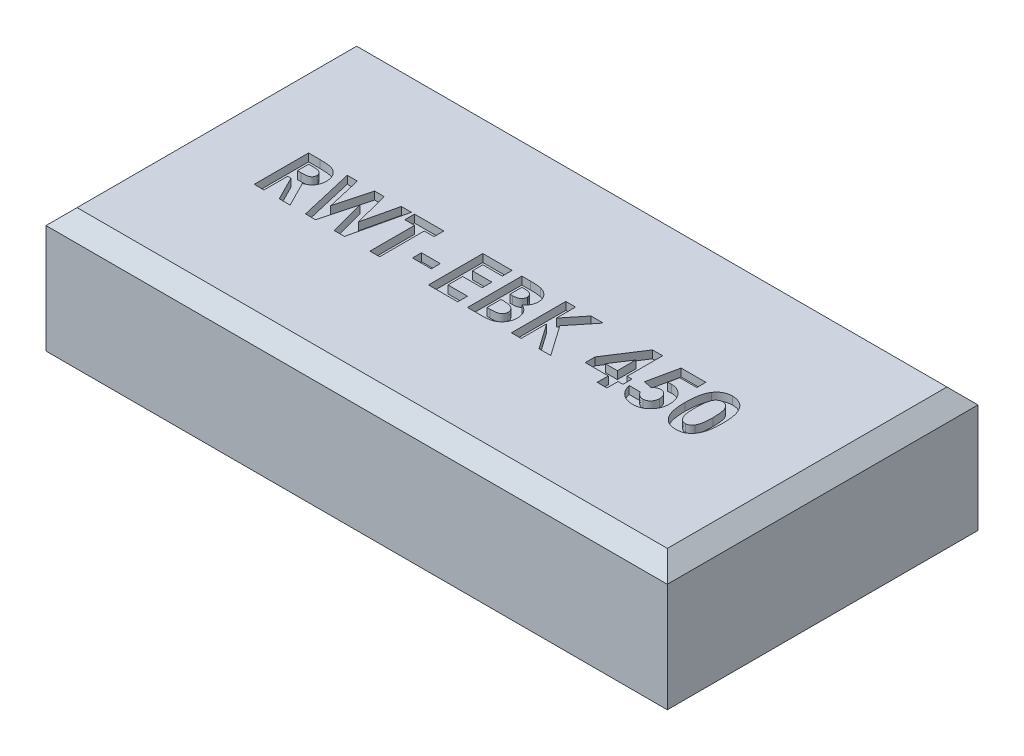
from build123d import *

# Parameters (mm, degrees)
SKETCH1_W           = 40
SKETCH1_H           = 20
BOSS_EXTRUDE1_DEPTH = 8
CHAMFER1_SIZE       = 1
SKETCH4_W           = 1.211538461
SKETCH4_H           = 0.583333333
CUT_EXTRUDE3_DEPTH  = 0.5


with BuildPart() as part:
    # Sketch1 → Boss-Extrude1 (new body)
    with BuildSketch(Plane(origin=(0, 0, 0), x_dir=(1, 0, 0), z_dir=(0, 1, 0))):
        with Locations((0, 2.318501171)):
            Rectangle(SKETCH1_W, SKETCH1_H)
    extrude(amount=BOSS_EXTRUDE1_DEPTH)

    # Chamfer1
    chamfer1_edges = [part.edges().sort_by_distance(p)[0] for p in [
        (0, 8, 7.681498829),
        (-20, 8, -2.318501171),
        (0, 8, -12.318501171),
        (20, 8, -2.318501171),
    ]]
    chamfer(chamfer1_edges, length=CHAMFER1_SIZE)

    # Sketch4 → Cut-Extrude3 (cut)
    # profile 1 of 10: a face of its own
    with BuildSketch(Plane(origin=(0, 8, 0), x_dir=(1, 0, 0), z_dir=(0, 1, 0))):
        with BuildLine():
            Line((-14.596153846, 3.818501171), (-13.864182692, 3.818501171))
            add(Edge.make_bspline(
                [(-13.864182692, 3.818501171), (-13.815799622, 3.818329439), (-13.722745349, 3.81799915), (-13.588566169, 3.81278806), (-13.46530414, 3.805536401), (-13.352776761, 3.794470177), (-13.251032173, 3.779797701), (-13.159968404, 3.76250128), (-13.079588115, 3.742788301), (-13.009213411, 3.718224373), (-12.945703721, 3.690516634), (-12.886503859, 3.658679935), (-12.830307791, 3.623068786), (-12.777491125, 3.582746162), (-12.727594872, 3.538437457), (-12.6805249, 3.49009807), (-12.636946351, 3.437318103), (-12.597129066, 3.380431058), (-12.560838815, 3.320587191), (-12.528765845, 3.257704336), (-12.502684052, 3.191738763), (-12.479637993, 3.123643816), (-12.463038663, 3.052446065), (-12.451494071, 2.978838632), (-12.443041573, 2.902562411), (-12.442555595, 2.850743733), (-12.442307692, 2.824310466)],
                knots=[0, 0, 0, 0, 1.749336639, 3.364467119, 4.854658419, 6.213483162, 7.451590619, 8.570285859, 9.5643256, 10.440900261, 11.26203566, 12.067320669, 12.869050712, 13.665104639, 14.467235401, 15.27997916, 16.102287765, 16.939272006, 17.78853747, 18.631303466, 19.488103222, 20.351255419, 21.228522269, 22.127379805, 23.044756219, 24, 24, 24, 24], degree=3))
            add(Edge.make_bspline(
                [(-12.442307692, 2.824310466), (-12.442951654, 2.796720207), (-12.444214347, 2.742620739), (-12.451015895, 2.663153032), (-12.46344699, 2.587123888), (-12.48227569, 2.514755912), (-12.503916836, 2.4451484), (-12.532694008, 2.379585653), (-12.565171892, 2.317114157), (-12.603744925, 2.258617595), (-12.646076944, 2.20279664), (-12.695308193, 2.151790002), (-12.748249241, 2.102856265), (-12.807876098, 2.059060474), (-12.871560358, 2.017441316), (-12.940567358, 1.979723274), (-13.014446736, 1.944958206), (-13.066387598, 1.925570802), (-13.092948718, 1.91565662)],
                knots=[0, 0, 0, 0, 1.099860209, 2.156625411, 3.176576793, 4.16617041, 5.135385252, 6.078461593, 7.016046972, 7.938469504, 8.868247731, 9.803980173, 10.76021508, 11.73834243, 12.748633912, 13.790971185, 14.870363756, 16, 16, 16, 16], degree=3))
            Line((-13.092948718, 1.91565662), (-12.28525641, 0.318501171))
            Line((-12.28525641, 0.318501171), (-12.983573718, 0.318501171))
            Line((-12.983573718, 0.318501171), (-13.754807692, 1.844142197))
            Line((-13.754807692, 1.844142197), (-13.967948718, 1.844142197))
            Line((-13.967948718, 1.844142197), (-13.967948718, 0.318501171))
            Line((-13.967948718, 0.318501171), (-14.596153846, 0.318501171))
            Line((-14.596153846, 0.318501171), (-14.596153846, 3.818501171))
        make_face()
        with BuildLine():
            Line((-13.967948718, 2.472347325), (-13.723257212, 2.472347325))
            add(Edge.make_bspline(
                [(-13.723257212, 2.472347325), (-13.693341641, 2.472684254), (-13.636059751, 2.473329401), (-13.55368087, 2.476321861), (-13.4788612, 2.483532211), (-13.41127944, 2.492642218), (-13.350595524, 2.503161037), (-13.297350732, 2.518235143), (-13.250724642, 2.534387429), (-13.211269776, 2.554460531), (-13.177560445, 2.577288002), (-13.148454596, 2.603220576), (-13.124379885, 2.633234229), (-13.104565169, 2.666513318), (-13.089151475, 2.70335219), (-13.07790066, 2.743346436), (-13.071613117, 2.786951643), (-13.070889714, 2.817045173), (-13.070512821, 2.832723927)],
                knots=[0, 0, 0, 0, 1.688639943, 3.233382647, 4.650958383, 5.928841754, 7.082724185, 8.122798841, 9.049171256, 9.863274652, 10.613301712, 11.341792392, 12.054588806, 12.776240173, 13.521029143, 14.301969904, 15.115324896, 16, 16, 16, 16], degree=3))
            add(Edge.make_bspline(
                [(-13.070512821, 2.832723927), (-13.071225372, 2.851273039), (-13.072625049, 2.88770933), (-13.086514186, 2.940164814), (-13.108622693, 2.988715953), (-13.1389274, 3.033143381), (-13.177092239, 3.072091531), (-13.220889403, 3.106424636), (-13.27126414, 3.133572687), (-13.317907356, 3.151479252), (-13.36034178, 3.162192934), (-13.398637509, 3.170176676), (-13.442984193, 3.175834983), (-13.493415313, 3.181836624), (-13.549802317, 3.185728385), (-13.612452548, 3.188568594), (-13.681186076, 3.189730664), (-13.729099873, 3.190102157), (-13.754106571, 3.190296043)],
                knots=[0, 0, 0, 0, 1.020303359, 2.004196876, 2.966617323, 3.9489082, 4.950758222, 5.960522915, 7.003732012, 8.091992268, 8.70421221, 9.413913587, 10.24622431, 11.166358409, 12.212345909, 13.359657661, 14.621978493, 16, 16, 16, 16], degree=3))
            Line((-13.754106571, 3.190296043), (-13.967948718, 3.190296043))
            Line((-13.967948718, 3.190296043), (-13.967948718, 2.472347325))
        make_face(mode=Mode.SUBTRACT)
    # profile 2 of 10: a face of its own
    with BuildSketch(Plane(origin=(0, 8, 0), x_dir=(1, 0, 0), z_dir=(0, 1, 0))):
        Polygon((-12.105769231, 3.818501171), (-11.457231571, 3.818501171), (-10.939102564, 1.584026011), (-10.345252404, 3.818501171), (-9.734575321, 3.818501171), (-9.144230769, 1.584026011), (-8.627504006, 3.818501171), (-7.977564103, 3.818501171), (-8.787359776, 0.318501171), (-9.443609776, 0.318501171), (-10.041666667, 2.581021203), (-10.643229167, 0.318501171), (-11.294571314, 0.318501171), align=None)
    # profile 3 of 10: a face of its own
    with BuildSketch(Plane(origin=(0, 8, 0), x_dir=(1, 0, 0), z_dir=(0, 1, 0))):
        Polygon((-7.775641026, 3.818501171), (-5.891025641, 3.818501171), (-5.891025641, 3.190296043), (-6.519230769, 3.190296043), (-6.519230769, 0.318501171), (-7.147435897, 0.318501171), (-7.147435897, 3.190296043), (-7.775641026, 3.190296043), align=None)
    # profile 4 of 10: a face of its own
    with BuildSketch(Plane(origin=(0, 8, 0), x_dir=(1, 0, 0), z_dir=(0, 1, 0))):
        with Locations((-4.791666667, 1.597347325)):
            Rectangle(SKETCH4_W, SKETCH4_H)
    # profile 5 of 10: a face of its own
    with BuildSketch(Plane(origin=(0, 8, 0), x_dir=(1, 0, 0), z_dir=(0, 1, 0))):
        Polygon((-3.378205128, 3.818501171), (-1.493589744, 3.818501171), (-1.493589744, 3.190296043), (-2.75, 3.190296043), (-2.75, 2.51721912), (-1.493589744, 2.51721912), (-1.493589744, 1.889013991), (-2.75, 1.889013991), (-2.75, 0.946706299), (-1.493589744, 0.946706299), (-1.493589744, 0.318501171), (-3.378205128, 0.318501171), align=None)
    # profile 6 of 10: a face of its own
    with BuildSketch(Plane(origin=(0, 8, 0), x_dir=(1, 0, 0), z_dir=(0, 1, 0))):
        with BuildLine():
            Line((-0.865384615, 0.318501171), (-0.865384615, 3.818501171))
            Line((-0.865384615, 3.818501171), (-0.304487179, 3.818501171))
            add(Edge.make_bspline(
                [(-0.304487179, 3.818501171), (-0.265220852, 3.818505652), (-0.189241252, 3.818514323), (-0.079622519, 3.814664873), (0.022039599, 3.809685178), (0.115421572, 3.804114058), (0.200682344, 3.794513904), (0.277692262, 3.784396391), (0.346605192, 3.772195293), (0.389210312, 3.76125053), (0.409254808, 3.756101331)],
                knots=[0, 0, 0, 0, 1.311965854, 2.538629056, 3.664479157, 4.713267157, 5.663616078, 6.530575999, 7.308677837, 8, 8, 8, 8], degree=3))
            add(Edge.make_bspline(
                [(0.409254808, 3.756101331), (0.435575266, 3.748838294), (0.487224455, 3.734585883), (0.561202576, 3.705802524), (0.631381143, 3.673807779), (0.697674471, 3.637307759), (0.759675491, 3.595861807), (0.817148578, 3.549140995), (0.871333285, 3.499020694), (0.920305637, 3.444104065), (0.964568575, 3.386074475), (1.003025131, 3.324947127), (1.03643895, 3.2616567), (1.063178757, 3.195406725), (1.083326699, 3.126502301), (1.09806282, 3.055237661), (1.107613822, 2.981387306), (1.108516267, 2.931144495), (1.108974359, 2.905640594)],
                knots=[0, 0, 0, 0, 1.099996261, 2.158545794, 3.195537121, 4.207578794, 5.205712374, 6.197378256, 7.190519799, 8.17788031, 9.159561366, 10.129234751, 11.085776129, 12.040971148, 13.00380137, 13.975669004, 14.972423361, 16, 16, 16, 16], degree=3))
            add(Edge.make_bspline(
                [(1.108974359, 2.905640594), (1.107776583, 2.872874775), (1.105418909, 2.808379286), (1.090357925, 2.713647082), (1.062116233, 2.624111532), (1.025162666, 2.538122532), (0.974917368, 2.456000819), (0.911115557, 2.377785442), (0.834790614, 2.30106803), (0.776245169, 2.255081117), (0.745793269, 2.231161427)],
                knots=[0, 0, 0, 0, 0.986156485, 1.941127874, 2.875419072, 3.804401753, 4.751181392, 5.761612777, 6.835722519, 8, 8, 8, 8], degree=3))
            add(Edge.make_bspline(
                [(0.745793269, 2.231161427), (0.770470028, 2.218564156), (0.818854324, 2.193864392), (0.887545811, 2.153265354), (0.951146629, 2.110083128), (1.009941945, 2.065186558), (1.062698461, 2.016672412), (1.111594582, 1.967336144), (1.154218027, 1.914350989), (1.192333195, 1.85960544), (1.225462281, 1.802306775), (1.254314061, 1.742551757), (1.278684124, 1.680136252), (1.299321324, 1.615377904), (1.314712554, 1.548053973), (1.324747963, 1.478140383), (1.332431699, 1.405875574), (1.333029422, 1.35665059), (1.333333333, 1.331622165)],
                knots=[0, 0, 0, 0, 1.164658916, 2.283573913, 3.35186032, 4.395461096, 5.390182219, 6.362969632, 7.312859996, 8.245001507, 9.165155236, 10.092416118, 11.032087915, 11.979892451, 12.947605196, 13.931445124, 14.948243989, 16, 16, 16, 16], degree=3))
            add(Edge.make_bspline(
                [(1.333333333, 1.331622165), (1.331361149, 1.283819302), (1.327469051, 1.189480545), (1.29901193, 1.050969584), (1.249676325, 0.91964863), (1.18342878, 0.796039608), (1.101799059, 0.683720797), (1.007948289, 0.585330494), (0.902821331, 0.502045287), (0.805829006, 0.445834233), (0.721938284, 0.40811136), (0.652453165, 0.384788701), (0.577827621, 0.363182624), (0.49669469, 0.348010391), (0.410525202, 0.334123096), (0.318478999, 0.325548791), (0.220728113, 0.319738197), (0.153588579, 0.318921849), (0.118990385, 0.318501171)],
                knots=[0, 0, 0, 0, 1.284142165, 2.534249414, 3.780121997, 5.041676246, 6.291546858, 7.49970053, 8.684500223, 9.883330709, 10.50184324, 11.153274765, 11.851151195, 12.587658647, 13.369265475, 14.195992086, 15.070362669, 16, 16, 16, 16], degree=3))
            Line((0.118990385, 0.318501171), (-0.865384615, 0.318501171))
        make_face()
        with BuildLine():
            Line((-0.237179487, 3.190296043), (-0.237179487, 2.42747553))
            Line((-0.237179487, 2.42747553), (-0.0703125, 2.42747553))
            add(Edge.make_bspline(
                [(-0.0703125, 2.42747553), (-0.047633777, 2.427673297), (-0.003853875, 2.428055074), (0.059381549, 2.432972233), (0.118180282, 2.441361212), (0.172319311, 2.453065948), (0.222302963, 2.467929257), (0.267811927, 2.485813017), (0.308646108, 2.507633149), (0.356085982, 2.540135198), (0.406233349, 2.587963419), (0.450377513, 2.657061193), (0.476378131, 2.736523371), (0.479273899, 2.792566252), (0.480769231, 2.821505979)],
                knots=[0, 0, 0, 0, 1.065314748, 2.056525647, 2.977365736, 3.853934255, 4.656397591, 5.425096493, 6.14721249, 6.826394842, 8.123232004, 9.372140726, 10.643011755, 12, 12, 12, 12], degree=3))
            add(Edge.make_bspline(
                [(0.480769231, 2.821505979), (0.479572691, 2.848612841), (0.47725923, 2.901022871), (0.451079951, 2.97461122), (0.410418355, 3.039825558), (0.362411626, 3.084459439), (0.317203962, 3.114943064), (0.278494386, 3.135015233), (0.236007719, 3.152983634), (0.188921466, 3.166722711), (0.137504514, 3.17703203), (0.082006625, 3.184602991), (0.022332045, 3.189756109), (-0.018885315, 3.190112204), (-0.040164263, 3.190296043)],
                knots=[0, 0, 0, 0, 1.347982417, 2.606269829, 3.849316587, 5.153353503, 5.842674298, 6.568177932, 7.326619318, 8.142485038, 9.012069166, 9.942760135, 10.937925643, 12, 12, 12, 12], degree=3))
            Line((-0.040164263, 3.190296043), (-0.237179487, 3.190296043))
        make_face(mode=Mode.SUBTRACT)
        with BuildLine():
            Line((-0.237179487, 1.844142197), (-0.237179487, 0.946706299))
            Line((-0.237179487, 0.946706299), (-0.056290064, 0.946706299))
            add(Edge.make_bspline(
                [(-0.056290064, 0.946706299), (-0.020527995, 0.946910607), (0.048229046, 0.947303413), (0.146723385, 0.952049449), (0.236279363, 0.960603342), (0.316659689, 0.971282188), (0.387987483, 0.985750355), (0.450021639, 1.004144774), (0.503612874, 1.02438184), (0.548439854, 1.049377018), (0.585060929, 1.078465208), (0.618107609, 1.108194036), (0.645051813, 1.142489048), (0.666370569, 1.179878054), (0.684821916, 1.219432285), (0.695950465, 1.262696318), (0.704423352, 1.308387911), (0.704889637, 1.339991798), (0.705128205, 1.356161427)],
                knots=[0, 0, 0, 0, 1.753078804, 3.370512758, 4.83203934, 6.162291463, 7.344201807, 8.395507345, 9.331626367, 10.147333109, 10.898971645, 11.62040215, 12.321813352, 13.025280112, 13.727906689, 14.453419512, 15.208716525, 16, 16, 16, 16], degree=3))
            add(Edge.make_bspline(
                [(0.705128205, 1.356161427), (0.704602095, 1.374651653), (0.703577374, 1.410665639), (0.695208464, 1.463303922), (0.67999942, 1.512445252), (0.660842888, 1.559346239), (0.634185556, 1.602327663), (0.602504228, 1.642876951), (0.564225095, 1.679620976), (0.521177978, 1.714782156), (0.470967777, 1.745567673), (0.413570936, 1.772279563), (0.348675643, 1.79458835), (0.27608088, 1.81235062), (0.196104895, 1.827425213), (0.108163951, 1.83642641), (0.012990452, 1.843120995), (-0.053004401, 1.843794061), (-0.087139423, 1.844142197)],
                knots=[0, 0, 0, 0, 0.845221588, 1.646264278, 2.427170338, 3.19324141, 3.95557735, 4.731569926, 5.540061037, 6.376114724, 7.268642756, 8.224665384, 9.265483498, 10.400594375, 11.639216012, 12.983232105, 14.439614077, 16, 16, 16, 16], degree=3))
            Line((-0.087139423, 1.844142197), (-0.237179487, 1.844142197))
        make_face(mode=Mode.SUBTRACT)
    # profile 7 of 10: a face of its own
    with BuildSketch(Plane(origin=(0, 8, 0), x_dir=(1, 0, 0), z_dir=(0, 1, 0))):
        Polygon((1.961538462, 3.818501171), (2.58974359, 3.818501171), (2.58974359, 2.586630177), (3.582532051, 3.818501171), (4.375500801, 3.818501171), (3.128205128, 2.270424248), (4.496794872, 0.318501171), (3.740284455, 0.318501171), (2.58974359, 1.959827293), (2.58974359, 0.318501171), (1.961538462, 0.318501171), align=None)
    # profile 8 of 10: a face of its own
    with BuildSketch(Plane(origin=(0, 8, 0), x_dir=(1, 0, 0), z_dir=(0, 1, 0))):
        Polygon((7.454126603, 3.908244761), (8.108974359, 3.908244761), (8.108974359, 1.619783222), (8.423076923, 1.619783222), (8.423076923, 1.036449889), (8.108974359, 1.036449889), (8.108974359, 0.318501171), (7.480769231, 0.318501171), (7.480769231, 1.036449889), (6, 1.036449889), (6, 1.672367357), align=None)
        Polygon((7.480769231, 1.619783222), (7.480769231, 2.810989152), (6.706029647, 1.619783222), align=None, mode=Mode.SUBTRACT)
    # profile 9 of 10: a face of its own
    with BuildSketch(Plane(origin=(0, 8, 0), x_dir=(1, 0, 0), z_dir=(0, 1, 0))):
        with BuildLine():
            Line((9.387119391, 3.818501171), (10.980769231, 3.818501171))
            Line((10.980769231, 3.818501171), (10.980769231, 3.235167838))
            Line((10.980769231, 3.235167838), (9.884915865, 3.235167838))
            Line((9.884915865, 3.235167838), (9.748197115, 2.573308863))
            add(Edge.make_bspline(
                [(9.748197115, 2.573308863), (9.766827002, 2.578497522), (9.803568967, 2.588730623), (9.858920782, 2.598993128), (9.912564404, 2.605644958), (9.947765022, 2.606532224), (9.96484375, 2.606962709)],
                knots=[0, 0, 0, 0, 1.05461699, 2.079921384, 3.068411212, 4, 4, 4, 4], degree=3))
            add(Edge.make_bspline(
                [(9.96484375, 2.606962709), (10.002060088, 2.606109919), (10.075421688, 2.60442888), (10.1827404, 2.588470341), (10.285504407, 2.563336125), (10.383399238, 2.527489548), (10.476329265, 2.480834303), (10.564407137, 2.424394534), (10.647740954, 2.358071113), (10.724850358, 2.281822516), (10.795701698, 2.19809983), (10.857302898, 2.107544887), (10.909914167, 2.011448911), (10.951759351, 1.909214572), (10.984787138, 1.801483971), (11.008653754, 1.688188071), (11.022767277, 1.569192598), (11.024670399, 1.488010495), (11.025641026, 1.446606139)],
                knots=[0, 0, 0, 0, 1.01440847, 1.999622559, 2.951875003, 3.895578053, 4.836219714, 5.782137149, 6.743708247, 7.735272588, 8.734977101, 9.730283169, 10.717124674, 11.717316708, 12.737475749, 13.78628267, 14.87096371, 16, 16, 16, 16], degree=3))
            add(Edge.make_bspline(
                [(11.025641026, 1.446606139), (11.024454904, 1.404731748), (11.022114339, 1.322101333), (11.006844297, 1.200605395), (10.979892399, 1.084239715), (10.94287127, 0.972692784), (10.894098303, 0.866784445), (10.835442135, 0.765417568), (10.765911048, 0.669344566), (10.68618738, 0.579550304), (10.599517296, 0.497476624), (10.507234115, 0.425276252), (10.409986156, 0.364520223), (10.30777107, 0.31541908), (10.2011753, 0.276571129), (10.090166491, 0.248291676), (9.974205155, 0.232074981), (9.895482475, 0.229875532), (9.85546875, 0.228757581)],
                knots=[0, 0, 0, 0, 1.06808661, 2.107647099, 3.116961351, 4.110378221, 5.100014249, 6.085620622, 7.093190682, 8.119403071, 9.144090782, 10.133780668, 11.103064255, 12.062861538, 13.020824475, 13.992378307, 14.979551724, 16, 16, 16, 16], degree=3))
            add(Edge.make_bspline(
                [(9.85546875, 0.228757581), (9.819685666, 0.229672135), (9.749113937, 0.231475826), (9.645164879, 0.242562264), (9.544946443, 0.262163189), (9.44899068, 0.290530803), (9.356287975, 0.32544486), (9.267909998, 0.369111487), (9.183371097, 0.420699211), (9.102911331, 0.479266557), (9.027838055, 0.545240399), (8.959319124, 0.617460138), (8.896939715, 0.695015476), (8.84203465, 0.778863212), (8.79477604, 0.868879466), (8.75286614, 0.964003375), (8.718562467, 1.065228337), (8.701154341, 1.135403104), (8.692307692, 1.171065274)],
                knots=[0, 0, 0, 0, 1.054957082, 2.080596141, 3.077793124, 4.061112343, 5.027190972, 5.994718051, 6.962465889, 7.943658696, 8.924948258, 9.904494768, 10.875059, 11.855380583, 12.854004648, 13.869083016, 14.917087635, 16, 16, 16, 16], degree=3))
            Line((8.692307692, 1.171065274), (9.41025641, 1.171065274))
            add(Edge.make_bspline(
                [(9.41025641, 1.171065274), (9.42338053, 1.146352842), (9.448885759, 1.098327052), (9.497402344, 1.034565599), (9.551713581, 0.980192572), (9.611329552, 0.934676733), (9.676636533, 0.900577041), (9.744973386, 0.874717413), (9.8171986, 0.859774091), (9.86638716, 0.857906028), (9.891225962, 0.856962709)],
                knots=[0, 0, 0, 0, 1.104910296, 2.147267069, 3.153527244, 4.136738762, 5.099945312, 6.05603338, 7.018353, 8, 8, 8, 8], degree=3))
            add(Edge.make_bspline(
                [(9.891225962, 0.856962709), (9.908538273, 0.857614079), (9.942600538, 0.858895659), (9.9927859, 0.86567554), (10.040690032, 0.87851648), (10.086669091, 0.896298197), (10.130846587, 0.918474006), (10.172589223, 0.946469521), (10.212623243, 0.978693396), (10.250339168, 1.015670402), (10.284498925, 1.056891163), (10.314453296, 1.10118568), (10.341236634, 1.14756972), (10.361075462, 1.197880672), (10.377321784, 1.250616232), (10.389286233, 1.306174201), (10.396436341, 1.364619465), (10.397098249, 1.404518409), (10.397435897, 1.424871363)],
                knots=[0, 0, 0, 0, 0.978869489, 1.925942215, 2.855067702, 3.774946051, 4.70828698, 5.642468714, 6.60995405, 7.609372294, 8.622401667, 9.629904756, 10.629323, 11.642352373, 12.678539694, 13.745912462, 14.850161547, 16, 16, 16, 16], degree=3))
            add(Edge.make_bspline(
                [(10.397435897, 1.424871363), (10.397044018, 1.444751879), (10.396281215, 1.483449786), (10.389971156, 1.540272174), (10.378682582, 1.594186337), (10.363301804, 1.645605217), (10.343612571, 1.694216573), (10.319551013, 1.740309765), (10.291014335, 1.783651807), (10.257849331, 1.823360298), (10.222482512, 1.859782055), (10.184487184, 1.891636234), (10.144205664, 1.918072991), (10.102889652, 1.941153049), (10.05888996, 1.957950212), (10.013195966, 1.969517798), (9.965855722, 1.978005628), (9.933565969, 1.978504319), (9.917167468, 1.978757581)],
                knots=[0, 0, 0, 0, 1.166249705, 2.270133367, 3.348514167, 4.393962215, 5.415026464, 6.420877785, 7.440098956, 8.453121383, 9.451844239, 10.415694839, 11.355045125, 12.27538808, 13.187007209, 14.108269027, 15.039275622, 16, 16, 16, 16], degree=3))
            add(Edge.make_bspline(
                [(9.917167468, 1.978757581), (9.899354884, 1.978081693), (9.863654645, 1.976727067), (9.810613025, 1.965704839), (9.75821094, 1.94786674), (9.706156979, 1.923256255), (9.654967869, 1.891048895), (9.603292704, 1.853273355), (9.552861163, 1.807184883), (9.520795387, 1.772858084), (9.504206731, 1.755099729)],
                knots=[0, 0, 0, 0, 0.88288272, 1.769486374, 2.674910571, 3.623812639, 4.617874466, 5.670434592, 6.794841017, 8, 8, 8, 8], degree=3))
            Line((9.504206731, 1.755099729), (8.975560897, 1.876393799))
            Line((8.975560897, 1.876393799), (9.387119391, 3.818501171))
        make_face()
    # profile 10 of 10: a face of its own
    with BuildSketch(Plane(origin=(0, 8, 0), x_dir=(1, 0, 0), z_dir=(0, 1, 0))):
        with BuildLine():
            add(Edge.make_bspline(
                [(12.608072917, 3.908244761), (12.638480652, 3.907793349), (12.698270385, 3.906905754), (12.786329406, 3.897292372), (12.871154591, 3.882769234), (12.953077785, 3.86251452), (13.031509297, 3.835708128), (13.107019968, 3.803621336), (13.178711003, 3.764571127), (13.247496691, 3.720461909), (13.313350535, 3.670524021), (13.374689786, 3.613592251), (13.432634627, 3.550976601), (13.485930767, 3.481730434), (13.535758465, 3.406483618), (13.581953994, 3.325224221), (13.624163718, 3.237554532), (13.662860706, 3.143316345), (13.697463675, 3.04109707), (13.726609713, 2.929724208), (13.751607317, 2.809172324), (13.772707059, 2.679141347), (13.788655053, 2.539458435), (13.799404323, 2.390216385), (13.80678098, 2.231702915), (13.807383012, 2.122963977), (13.807692308, 2.067098927)],
                knots=[0, 0, 0, 0, 0.879237366, 1.728815576, 2.559023295, 3.367336655, 4.166867292, 4.954216142, 5.737608147, 6.525189134, 7.316157332, 8.124696809, 8.942788509, 9.781158001, 10.649253743, 11.551476218, 12.482711956, 13.461909668, 14.496590415, 15.601789533, 16.789733467, 18.056700938, 19.410929216, 20.8549011, 22.384193279, 24, 24, 24, 24], degree=3))
            add(Edge.make_bspline(
                [(13.807692308, 2.067098927), (13.807358042, 2.010534943), (13.806708571, 1.900632136), (13.799710973, 1.740668821), (13.787660778, 1.590343185), (13.772129618, 1.449670779), (13.750856176, 1.31872589), (13.725942019, 1.19716946), (13.69633592, 1.085045549), (13.660593141, 0.982606796), (13.622130387, 0.888203106), (13.579805201, 0.800704352), (13.534355307, 0.71987354), (13.486823186, 0.644491226), (13.434602955, 0.576779642), (13.380236318, 0.514436242), (13.321356056, 0.459835764), (13.260441254, 0.410164346), (13.195260358, 0.367238273), (13.12648556, 0.329695837), (13.052890726, 0.299244462), (12.975817364, 0.272759483), (12.893951743, 0.253746125), (12.808594697, 0.238659651), (12.718782561, 0.23032194), (12.657634842, 0.229287592), (12.626302083, 0.228757581)],
                knots=[0, 0, 0, 0, 1.643780988, 3.193836972, 4.651895693, 6.025988579, 7.305620092, 8.505800249, 9.631074763, 10.672816429, 11.65661981, 12.592235626, 13.49536222, 14.350718032, 15.179365177, 15.97804903, 16.751647189, 17.51006938, 18.259804725, 19.016521909, 19.783502495, 20.571750527, 21.382245291, 22.22305063, 23.089471752, 24, 24, 24, 24], degree=3))
            add(Edge.make_bspline(
                [(12.626302083, 0.228757581), (12.59497017, 0.229297816), (12.533591414, 0.230356128), (12.443536417, 0.238597657), (12.357727022, 0.253807241), (12.275213712, 0.272905453), (12.196570768, 0.299185861), (12.1214211, 0.330548319), (12.050342543, 0.367856509), (11.983138292, 0.410882596), (11.920037802, 0.460221675), (11.86006049, 0.515346009), (11.803339031, 0.576115872), (11.750736299, 0.643211936), (11.701390812, 0.71573861), (11.655817167, 0.794524112), (11.614042751, 0.879453732), (11.574760854, 0.970645855), (11.540629858, 1.070063741), (11.510254856, 1.17859518), (11.485372454, 1.297144871), (11.46536036, 1.425674728), (11.449382717, 1.563912456), (11.437497186, 1.711924777), (11.43046072, 1.869780633), (11.429818059, 1.978282826), (11.429487179, 2.034146203)],
                knots=[0, 0, 0, 0, 0.917216111, 1.796812873, 2.643793957, 3.46689424, 4.273913431, 5.068098542, 5.848489301, 6.620921603, 7.401012384, 8.190319798, 9.003608147, 9.831726257, 10.68377682, 11.569763213, 12.493818149, 13.453288342, 14.474581811, 15.568529029, 16.750744269, 18.018426408, 19.375425659, 20.823733699, 22.36466933, 24, 24, 24, 24], degree=3))
            add(Edge.make_bspline(
                [(11.429487179, 2.034146203), (11.430086537, 2.111763968), (11.431243006, 2.261528446), (11.445898626, 2.477894573), (11.46740936, 2.677887577), (11.499003532, 2.861172919), (11.538069289, 3.028429436), (11.588095025, 3.178555327), (11.645045686, 3.313627923), (11.693574966, 3.393645742), (11.716947115, 3.432183062)],
                knots=[0, 0, 0, 0, 1.288568992, 2.486310467, 3.599230591, 4.627010532, 5.572937695, 6.447898582, 7.252493626, 8, 8, 8, 8], degree=3))
            add(Edge.make_bspline(
                [(11.716947115, 3.432183062), (11.744123137, 3.470042113), (11.797257615, 3.544064019), (11.890164735, 3.641240945), (11.989981339, 3.72435141), (12.098757603, 3.791514551), (12.214773185, 3.844479409), (12.339024139, 3.881887892), (12.471051626, 3.903683818), (12.561717103, 3.906701743), (12.608072917, 3.908244761)],
                knots=[0, 0, 0, 0, 1.058512271, 2.069600068, 3.047294572, 4.004278952, 4.967380941, 5.939006123, 6.946246673, 8, 8, 8, 8], degree=3))
        make_face()
        with BuildLine():
            add(Edge.make_bspline(
                [(12.623497596, 3.280039632), (12.596008751, 3.278736716), (12.542116023, 3.276182308), (12.463915106, 3.254498986), (12.390176524, 3.221007927), (12.334085555, 3.180706674), (12.292102022, 3.142073089), (12.262767826, 3.107110952), (12.234479618, 3.068095726), (12.209494048, 3.023266856), (12.185901148, 2.974235095), (12.162843773, 2.920777869), (12.14394278, 2.861582152), (12.125373055, 2.797656056), (12.109104244, 2.727232193), (12.095474546, 2.649734927), (12.08329761, 2.564660285), (12.074804052, 2.471952543), (12.066885506, 2.371708697), (12.061209118, 2.263705442), (12.058835962, 2.147971914), (12.058081608, 2.068267952), (12.057692308, 2.027134985)],
                knots=[0, 0, 0, 0, 1.076674018, 2.110852608, 3.161083442, 4.239746716, 4.804137807, 5.395870207, 6.026861976, 6.692161227, 7.405688833, 8.16177676, 8.973626916, 9.841385931, 10.773283133, 11.807421078, 12.927755683, 14.143907515, 15.458935494, 16.872852025, 18.386167141, 20, 20, 20, 20], degree=3))
            add(Edge.make_bspline(
                [(12.057692308, 2.027134985), (12.05833305, 1.973845238), (12.05956172, 1.871658197), (12.065996919, 1.724709674), (12.078895741, 1.590974686), (12.094939272, 1.46954686), (12.117473067, 1.361213689), (12.143399656, 1.264950241), (12.175416688, 1.181983641), (12.212418538, 1.111114005), (12.253399754, 1.050825352), (12.297886667, 0.999579726), (12.344364656, 0.955203432), (12.394284452, 0.919157115), (12.44752696, 0.891532879), (12.503647703, 0.871663107), (12.562682345, 0.859499993), (12.603108659, 0.85781336), (12.623497596, 0.856962709)],
                knots=[0, 0, 0, 0, 1.771748488, 3.397459088, 4.888034009, 6.237357457, 7.467047327, 8.564189669, 9.548206622, 10.417051504, 11.216568818, 11.965764335, 12.669334354, 13.348544111, 14.005342236, 14.656555988, 15.322436492, 16, 16, 16, 16], degree=3))
            add(Edge.make_bspline(
                [(12.623497596, 0.856962709), (12.64318685, 0.857544788), (12.681735959, 0.858684424), (12.737949195, 0.87038264), (12.791108425, 0.889401398), (12.841053145, 0.916304766), (12.887962, 0.950516515), (12.931605729, 0.992186986), (12.971655179, 1.041731537), (12.994988171, 1.07850092), (13.007011218, 1.097447485)],
                knots=[0, 0, 0, 0, 0.992283464, 1.942767638, 2.88273346, 3.832339453, 4.79467288, 5.803907806, 6.868395428, 8, 8, 8, 8], degree=3))
            add(Edge.make_bspline(
                [(13.007011218, 1.097447485), (13.021166331, 1.12333736), (13.050848455, 1.177626329), (13.085196661, 1.269236938), (13.114109066, 1.372558565), (13.13899355, 1.487912756), (13.156013019, 1.615754481), (13.170670165, 1.755273086), (13.177739671, 1.907171129), (13.178889565, 2.012406641), (13.179487179, 2.067098927)],
                knots=[0, 0, 0, 0, 0.710965849, 1.490837728, 2.352621235, 3.297892224, 4.334225155, 5.461620853, 6.680770821, 8, 8, 8, 8], degree=3))
            add(Edge.make_bspline(
                [(13.179487179, 2.067098927), (13.179256334, 2.122265969), (13.178811995, 2.228453106), (13.170659668, 2.380897234), (13.15930693, 2.520129644), (13.142701151, 2.645839487), (13.121334799, 2.758331932), (13.095000689, 2.857599625), (13.063954732, 2.943838204), (13.027137927, 3.016961676), (12.986361029, 3.079106596), (12.943075106, 3.132422118), (12.897097128, 3.177941565), (12.848503986, 3.215836235), (12.796170975, 3.244790606), (12.741097722, 3.265234787), (12.683171324, 3.27760283), (12.64365732, 3.279216402), (12.623497596, 3.280039632)],
                knots=[0, 0, 0, 0, 1.793836731, 3.452829483, 4.963243077, 6.335886805, 7.574563692, 8.684454726, 9.672768357, 10.54971625, 11.340229787, 12.085688095, 12.778991901, 13.440269426, 14.083255152, 14.715733572, 15.344777694, 16, 16, 16, 16], degree=3))
        make_face(mode=Mode.SUBTRACT)
    extrude(amount=-CUT_EXTRUDE3_DEPTH, mode=Mode.SUBTRACT)


solid = part.part
